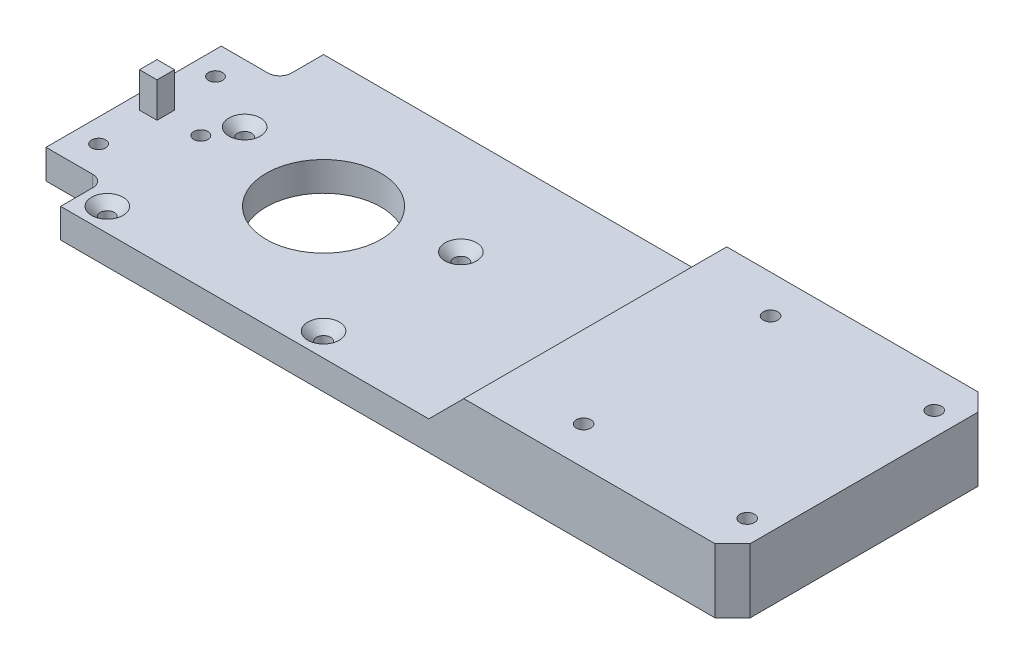
from build123d import *

# Parameters (mm, degrees)
SKETCH1_W                                           = 115
SKETCH1_H                                           = 45
BOSS_EXTRUDE1_DEPTH                                 = 5
CUT_EXTRUDE1_REACH                                  = 119.287
SKETCH2_R                                           = 9.8171
CSK_FOR_M2_COUNTERSUNK_FLAT_HEAD_SCREW1_D           = 2.4
CSK_FOR_M2_COUNTERSUNK_FLAT_HEAD_SCREW1_CSINK_D     = 5.4
CSK_FOR_M2_COUNTERSUNK_FLAT_HEAD_SCREW1_CSINK_ANGLE = 90
SKETCH13_W                                          = 52
SKETCH13_H                                          = 45
BOSS_EXTRUDE4_DEPTH                                 = 6
CHAMFER2_SIZE                                       = 6
M3_TAPPED_HOLE1_D                                   = 2.5
CHAMFER1_SIZE                                       = 3
SKETCH14_W                                          = 10
SKETCH14_H                                          = 30
BOSS_EXTRUDE5_DEPTH                                 = 5
FILLET1_R                                           = 2
CSK_FOR_M2_COUNTERSUNK_FLAT_HEAD_SCREW2_D           = 2.4
CSK_FOR_M2_COUNTERSUNK_FLAT_HEAD_SCREW2_DEPTH       = 5
CSK_FOR_M2_COUNTERSUNK_FLAT_HEAD_SCREW2_CSINK_D     = 5.4
CSK_FOR_M2_COUNTERSUNK_FLAT_HEAD_SCREW2_CSINK_ANGLE = 90
CSK_FOR_M2_COUNTERSUNK_FLAT_HEAD_SCREW2_TIP         = 0.721032743
SKETCH17_W                                          = 3
SKETCH17_H                                          = 3
BOSS_EXTRUDE6_DEPTH                                 = 6


with BuildPart() as part:
    # Sketch1 → Boss-Extrude1 (new body)
    with BuildSketch(Plane(origin=(0, 0, 0), x_dir=(1, 0, 0), z_dir=(0, 1, 0))):
        with Locations((57.5, 0)):
            Rectangle(SKETCH1_W, SKETCH1_H)
    extrude(amount=BOSS_EXTRUDE1_DEPTH)

    # Sketch2 → Cut-Extrude1 (cut, up to next)
    with BuildSketch(Plane(origin=(0, 5, 0), x_dir=(1, 0, 0), z_dir=(0, 1, 0)), mode=Mode.PRIVATE) as cut_extrude1_sk1:
        with Locations(Location((22.5, 0, 0), (0, 0, 270))):
            Circle(SKETCH2_R)
    cut_extrude1_tool1 = extrude(cut_extrude1_sk1.sketch, amount=-CUT_EXTRUDE1_REACH, mode=Mode.PRIVATE) & part.part
    add(cut_extrude1_tool1.solids().sort_by_distance((22.5, 5, 0))[0], mode=Mode.SUBTRACT)

    # CSK for M2 Countersunk Flat Head Screw1 (through all)
    with Locations(Plane(origin=(0, 5, 0), x_dir=(1, 0, 0), z_dir=(0, 1, 0))):
        with Locations((4, -18.5), (41, -18.5), (41, 5), (4, 5)):
            CounterSinkHole(CSK_FOR_M2_COUNTERSUNK_FLAT_HEAD_SCREW1_D / 2, CSK_FOR_M2_COUNTERSUNK_FLAT_HEAD_SCREW1_CSINK_D / 2, counter_sink_angle=CSK_FOR_M2_COUNTERSUNK_FLAT_HEAD_SCREW1_CSINK_ANGLE)

    # Sketch13 → Boss-Extrude4 (add)
    with BuildSketch(Plane(origin=(0, 5, 0), x_dir=(1, 0, 0), z_dir=(0, 1, 0))):
        with Locations((89, 0)):
            Rectangle(SKETCH13_W, SKETCH13_H)
    extrude(amount=BOSS_EXTRUDE4_DEPTH)

    # Chamfer2
    chamfer2_edges = [part.edges().sort_by_distance(p)[0] for p in [
        (63, 11, 0),
    ]]
    chamfer(chamfer2_edges, length=CHAMFER2_SIZE - 0.0001)  # a hair under: the kernel refuses the full size

    # M3 Tapped Hole1 (through all)
    with Locations(Plane(origin=(0, 11, 0), x_dir=(1, 0, 0), z_dir=(0, 1, 0))):
        with Locations((83, 16), (111, 16), (83, -16), (111, -16)):
            Hole(M3_TAPPED_HOLE1_D / 2)

    # Chamfer1
    chamfer1_edges = [part.edges().sort_by_distance(p)[0] for p in [
        (115, 5.5, -22.5),
        (115, 5.5, 22.5),
    ]]
    chamfer(chamfer1_edges, length=CHAMFER1_SIZE)

    # Sketch14 → Boss-Extrude5 (add)
    with BuildSketch(Plane(origin=(0, 0, 0), x_dir=(1, 0, 0), z_dir=(0, 1, 0))):
        with Locations((-5, 0)):
            Rectangle(SKETCH14_W, SKETCH14_H)
    extrude(amount=BOSS_EXTRUDE5_DEPTH)

    # Fillet1
    fillet1_edges = [part.edges().sort_by_distance(p)[0] for p in [
        (0, 2.5, -15),
        (0, 2.5, 15),
    ]]
    fillet(fillet1_edges, radius=FILLET1_R)

    # CSK for M2 Countersunk Flat Head Screw2
    with Locations(Plane(origin=(0, 0, 0), x_dir=(-1, 0, 0), z_dir=(0, -1, 0))):
        with Locations((-1.5, 0), (6, -10), (6, 10)):
            CounterSinkHole(CSK_FOR_M2_COUNTERSUNK_FLAT_HEAD_SCREW2_D / 2, CSK_FOR_M2_COUNTERSUNK_FLAT_HEAD_SCREW2_CSINK_D / 2, depth=CSK_FOR_M2_COUNTERSUNK_FLAT_HEAD_SCREW2_DEPTH, counter_sink_angle=CSK_FOR_M2_COUNTERSUNK_FLAT_HEAD_SCREW2_CSINK_ANGLE)
            with Locations((0, 0, -(CSK_FOR_M2_COUNTERSUNK_FLAT_HEAD_SCREW2_DEPTH + CSK_FOR_M2_COUNTERSUNK_FLAT_HEAD_SCREW2_TIP / 2))):  # 118° drill point
                Cone(0, CSK_FOR_M2_COUNTERSUNK_FLAT_HEAD_SCREW2_D / 2, CSK_FOR_M2_COUNTERSUNK_FLAT_HEAD_SCREW2_TIP, mode=Mode.SUBTRACT)

    # Sketch17 → Boss-Extrude6 (add)
    with BuildSketch(Plane(origin=(0, 5, 0), x_dir=(1, 0, 0), z_dir=(0, 1, 0))):
        with Locations((-6, 0)):
            Rectangle(SKETCH17_W, SKETCH17_H)
    extrude(amount=BOSS_EXTRUDE6_DEPTH)


solid = part.part
